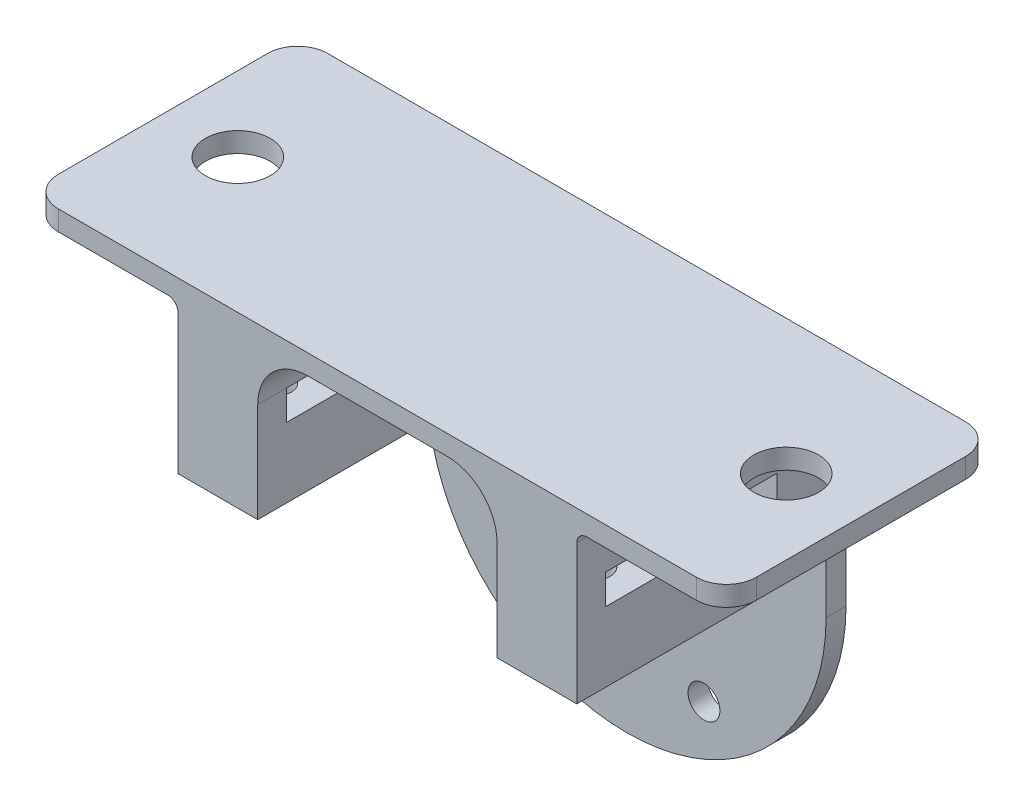
from build123d import *

# Parameters (mm, degrees)
SKETCH1_W           = 40
SKETCH1_H           = 40
SKETCH1_R           = 1.6
SKETCH1_R_2         = 6.25
BOSS_EXTRUDE1_DEPTH = 2
SKETCH2_W           = 40
SKETCH2_H           = 25
BOSS_EXTRUDE2_DEPTH = 2
SKETCH3_W           = 8
SKETCH3_H           = 23
BOSS_EXTRUDE3_DEPTH = 15
CUT_EXTRUDE1_DEPTH  = 15
SKETCH5_R           = 1.6
CUT_EXTRUDE2_DEPTH  = 15
BOSS_EXTRUDE4_START = 2
SKETCH8_R           = 1.6
SKETCH8_R_2         = 6.25
BOSS_EXTRUDE4_DEPTH = 2
CUT_EXTRUDE6_START  = -2
SKETCH9_R           = 6.25
SKETCH9_R_2         = 1.6
CUT_EXTRUDE6_DEPTH  = 2
CUT_EXTRUDE5_START  = -10
SKETCH7_W           = 8
SKETCH7_H           = 5.7
CUT_EXTRUDE5_DEPTH  = 3
SKETCH10_W          = 15
SKETCH10_H          = 27
SKETCH10_R          = 3.25
BOSS_EXTRUDE5_DEPTH = 2
FILLET2_START       = -1
FILLET2_DEPTH       = 26
FILLET3_R           = 1
FILLET4_R           = 3


with BuildPart() as part:
    # Sketch1 → Boss-Extrude1 (new body)
    with BuildSketch(Plane.XY):
        Rectangle(SKETCH1_W, SKETCH1_H)
        with Locations((-15.5, 0)):
            Circle(SKETCH1_R, mode=Mode.SUBTRACT)
        with Locations((7.75, 13.423393759)):
            Circle(SKETCH1_R, mode=Mode.SUBTRACT)
        with Locations((7.75, -13.423393759)):
            Circle(SKETCH1_R, mode=Mode.SUBTRACT)
        with Locations((0, 7)):
            Circle(SKETCH1_R_2, mode=Mode.SUBTRACT)
    extrude(amount=BOSS_EXTRUDE1_DEPTH)

    # Sketch2 → Boss-Extrude2 (add)
    with BuildSketch(Plane(origin=(0, 20, 0), x_dir=(1, 0, 0), z_dir=(0, 1, 0))):
        with Locations((0, -12.5)):
            Rectangle(SKETCH2_W, SKETCH2_H)
    extrude(amount=BOSS_EXTRUDE2_DEPTH)

    # Sketch3 → Boss-Extrude3 (add)
    with BuildSketch(Plane.XZ.offset(-20)):
        with Locations((-16, 13.5)):
            Rectangle(SKETCH3_W, SKETCH3_H)
        with Locations((16, 13.5)):
            Rectangle(SKETCH3_W, SKETCH3_H)
    extrude(amount=BOSS_EXTRUDE3_DEPTH)

    # Sketch4 → Cut-Extrude1 (cut)
    with BuildSketch(Plane.XY.offset(2)):
        with BuildLine():
            ThreePointArc((3.6e-08, -20), (-14.142135611, -14.142135636), (-20, 0))
            Line((-20, 0), (-20, -20))
            Line((-20, -20), (3.6e-08, -20))
        make_face()
        with BuildLine():
            ThreePointArc((20, 0), (14.142135636, -14.142135611), (3.6e-08, -20))
            Line((3.6e-08, -20), (20, -20))
            Line((20, -20), (20, 0))
        make_face()
    extrude(amount=-CUT_EXTRUDE1_DEPTH, mode=Mode.SUBTRACT)

    # Sketch5 → Cut-Extrude2 (cut)
    with BuildSketch(Plane.XZ.offset(-5)):
        with Locations(Location((-16, 7.75, 0), (0, 0, 270))):
            Circle(SKETCH5_R)
        with Locations(Location((-16, 19.25, 0), (0, 0, 270))):
            Circle(SKETCH5_R)
        with Locations(Location((16, 7.75, 0), (0, 0, 90))):
            Circle(SKETCH5_R)
        with Locations(Location((16, 19.25, 0), (0, 0, 90))):
            Circle(SKETCH5_R)
    extrude(amount=-CUT_EXTRUDE2_DEPTH, mode=Mode.SUBTRACT)

    # Sketch8 → Boss-Extrude4 (add)
    with BuildSketch(Plane(origin=(0, 0, 0), x_dir=(-1, 0, 0), z_dir=(0, 0, -1)).offset(BOSS_EXTRUDE4_START)):
        with BuildLine():
            Line((-20, 22), (-20, 0))
            ThreePointArc((-20, 0), (0, -20), (20, 0))
            Line((20, 0), (20, 22))
            Line((20, 22), (-20, 22))
        make_face()
        with Locations((-7.75, 13.423393759)):
            Circle(SKETCH8_R, mode=Mode.SUBTRACT)
        with Locations((0, 7)):
            Circle(SKETCH8_R_2, mode=Mode.SUBTRACT)
        with Locations((15.5, 0)):
            Circle(SKETCH8_R, mode=Mode.SUBTRACT)
        with Locations((-7.75, -13.423393759)):
            Circle(SKETCH8_R, mode=Mode.SUBTRACT)
    extrude(amount=-BOSS_EXTRUDE4_DEPTH)

    # Sketch9 → Cut-Extrude6 (cut)
    with BuildSketch(Plane.XY.offset(2).offset(CUT_EXTRUDE6_START)):
        with BuildLine():
            Line((20, 0), (20, 5))
            Line((20, 5), (12, 5))
            Line((12, 5), (12, 20))
            Line((12, 20), (-12, 20))
            Line((-12, 20), (-12, 5))
            Line((-12, 5), (-20, 5))
            Line((-20, 5), (-20, 0))
            ThreePointArc((-20, 0), (0, -20), (20, 0))
        make_face()
        with Locations(Location((0, 7, 0), (0, 0, 180))):
            Circle(SKETCH9_R, mode=Mode.SUBTRACT)
        with Locations(Location((7.75, 13.423393759, 0), (0, 0, 180))):
            Circle(SKETCH9_R_2, mode=Mode.SUBTRACT)
        with Locations(Location((-15.5, 0, 0), (0, 0, 180))):
            Circle(SKETCH9_R_2, mode=Mode.SUBTRACT)
        with Locations(Location((7.75, -13.423393759, 0), (0, 0, 180))):
            Circle(SKETCH9_R_2, mode=Mode.SUBTRACT)
    extrude(amount=CUT_EXTRUDE6_DEPTH, mode=Mode.SUBTRACT)

    # Sketch7 → Cut-Extrude5 (cut)
    with BuildSketch(Plane.XZ.offset(-5).offset(CUT_EXTRUDE5_START)):
        with Locations((-16, 19.25)):
            Rectangle(SKETCH7_W, SKETCH7_H)
        with Locations((16, 19.25)):
            Rectangle(SKETCH7_W, SKETCH7_H)
        with Locations((16, 7.75)):
            Rectangle(SKETCH7_W, SKETCH7_H)
        with Locations((-16, 7.75)):
            Rectangle(SKETCH7_W, SKETCH7_H)
    extrude(amount=CUT_EXTRUDE5_DEPTH, mode=Mode.SUBTRACT)

    # Sketch10 → Boss-Extrude5 (add)
    # profile 1 of 2: a face of its own
    with BuildSketch(Plane.XZ.offset(-20)):
        with Locations((-27.5, 11.5)):
            Rectangle(SKETCH10_W, SKETCH10_H)
        with Locations(Location((-27.5, 11.5, 0), (0, 0, 270))):
            Circle(SKETCH10_R, mode=Mode.SUBTRACT)
    # profile 2 of 2: a face of its own
    with BuildSketch(Plane.XZ.offset(-20)):
        with Locations((27.5, 11.5)):
            Rectangle(SKETCH10_W, SKETCH10_H)
        with Locations(Location((27.5, 11.5, 0), (0, 0, 270))):
            Circle(SKETCH10_R, mode=Mode.SUBTRACT)
    extrude(amount=-BOSS_EXTRUDE5_DEPTH)

    # Fillet2: read off the stored shape, not the designer's step
    # Fillet2 outline → Fillet2 (add)
    with BuildSketch(Plane.XY.offset(FILLET2_START)):
        with BuildLine():
            ThreePointArc((-12, 15), (-10.535533906, 18.535533906), (-7, 20))
            Line((-7, 20), (-12, 20))
            Line((-12, 20), (-12, 15))
        make_face()
        with BuildLine():
            ThreePointArc((7, 20), (10.535533906, 18.535533906), (12, 15))
            Line((12, 15), (12, 20))
            Line((12, 20), (7, 20))
        make_face()
    extrude(amount=FILLET2_DEPTH)

    # Fillet3
    fillet3_edges = [part.edges().sort_by_distance(p)[0] for p in [
        (-20, 20, 11.5),
        (20, 20, 11.5),
    ]]
    fillet(fillet3_edges, radius=FILLET3_R)

    # Fillet4
    fillet4_edges = [part.edges().sort_by_distance(p)[0] for p in [
        (-35, 21, -2),
        (-35, 21, 25),
        (35, 21, 25),
        (35, 21, -2),
    ]]
    fillet(fillet4_edges, radius=FILLET4_R)


solid = part.part
